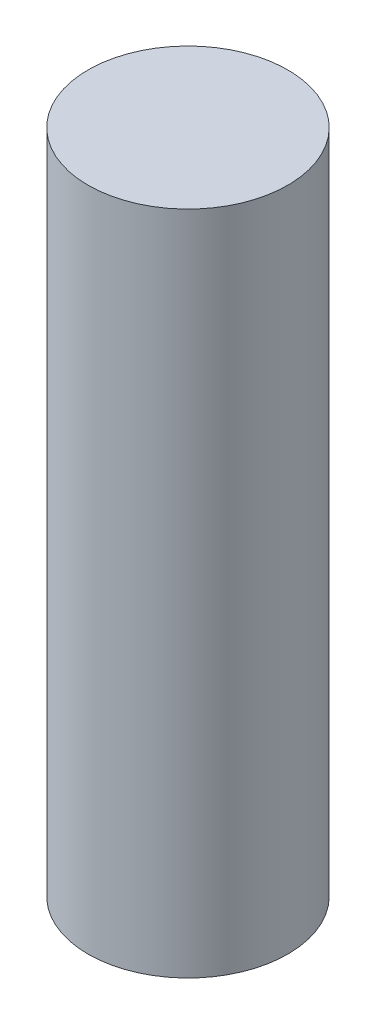
from build123d import *

# Parameters (mm, degrees)
SKETCH1_R           = 15
BOSS_EXTRUDE1_DEPTH = 100


with BuildPart() as part:
    # Sketch1 → Boss-Extrude1 (new body)
    with BuildSketch(Plane(origin=(0, 0, 0), x_dir=(1, 0, 0), z_dir=(0, 1, 0))):
        Circle(SKETCH1_R)
    extrude(amount=BOSS_EXTRUDE1_DEPTH)


solid = part.part
